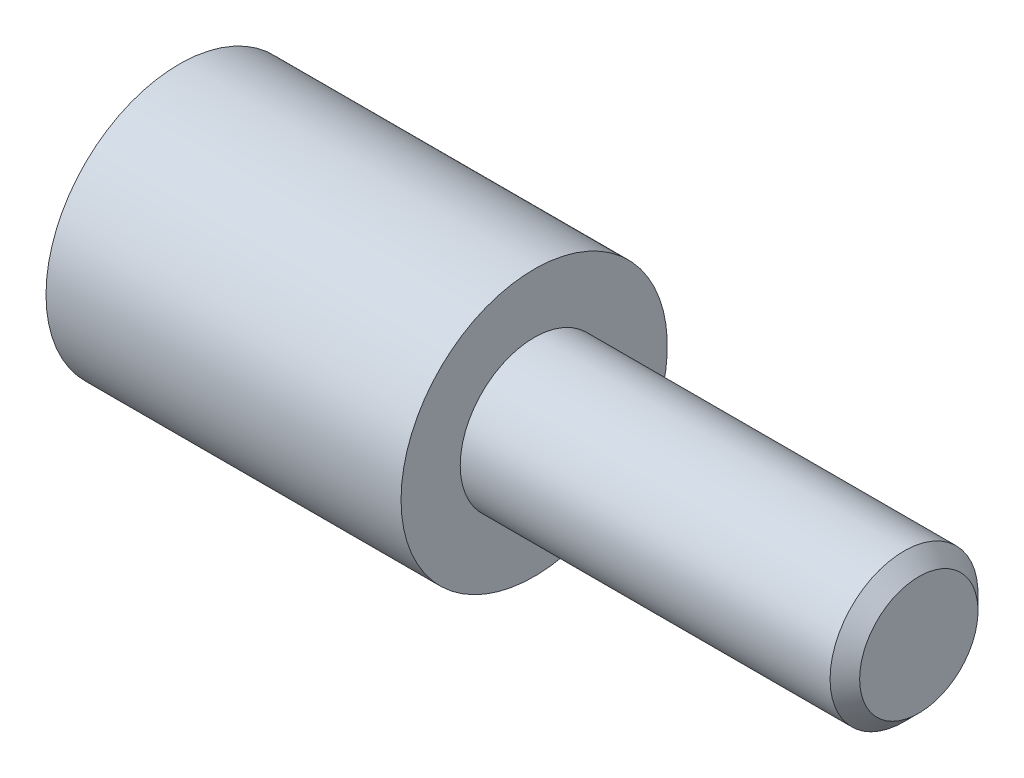
from build123d import *

# Parameters (mm, degrees)
CHANFREIN1_SIZE = 0.5


with BuildPart() as part:
    # Esquisse1 → Révolution1 (revolve)
    with BuildSketch(Plane.XY):
        Polygon((0, 2.8), (0, 4.5), (12, 4.5), (12, 2.5), (25, 2.5), (25, 0), (10, 0), (10, 2.8), align=None)
    revolve(axis=Axis((-11.705244739, 0, 0), (1, 0, 0)))

    # Chanfrein1
    chanfrein1_edges = [part.edges().sort_by_distance(p)[0] for p in [
        (25, -2.5, 0),
    ]]
    chamfer(chanfrein1_edges, length=CHANFREIN1_SIZE)


solid = part.part
